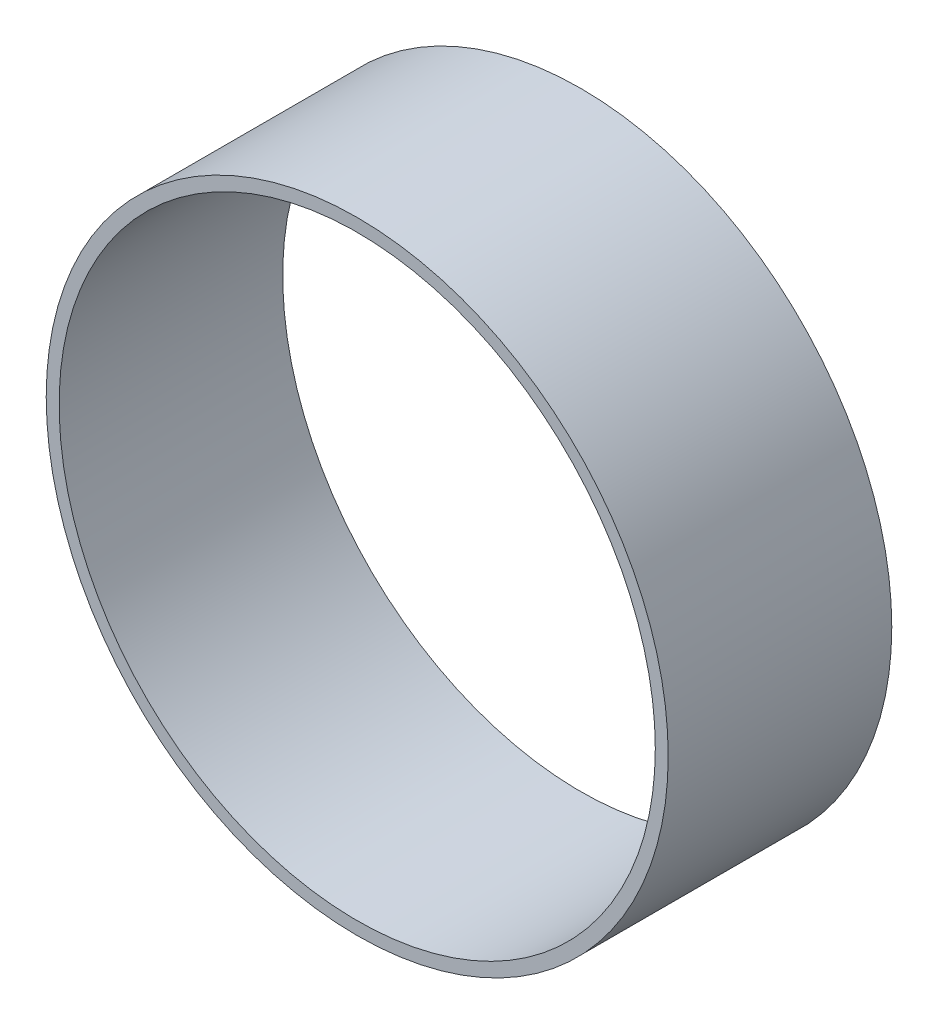
from build123d import *

# Parameters (mm, degrees)
SKETCH1_R           = 39.75
SKETCH1_R_2         = 38.1
BOSS_EXTRUDE1_DEPTH = 28.575


with BuildPart() as part:
    # Sketch1 → Boss-Extrude1 (new body)
    with BuildSketch(Plane.XY):
        Circle(SKETCH1_R)
        Circle(SKETCH1_R_2, mode=Mode.SUBTRACT)
    extrude(amount=BOSS_EXTRUDE1_DEPTH)


solid = part.part
